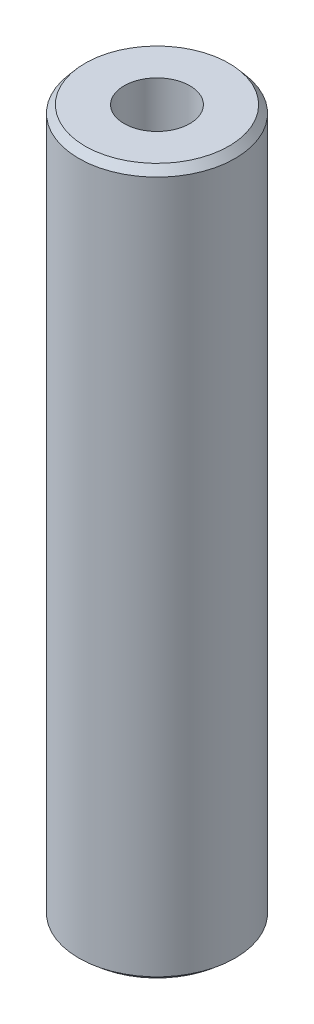
from build123d import *
from OCP.BRepFilletAPI import BRepFilletAPI_MakeChamfer

# Parameters (mm, degrees)
SKETCH1_R           = 7.5
BOSS_EXTRUDE1_DEPTH = 67.74205886
SKETCH2_R           = 3.150925498
CUT_EXTRUDE1_DEPTH  = 69.567386844
CHAMFER1_SIZE       = 0.717238058
CHAMFER1_SIZE2      = 0.606300994


with BuildPart() as part:
    # Sketch1 → Boss-Extrude1 (new body)
    with BuildSketch(Plane(origin=(0, 0, 0), x_dir=(1, 0, 0), z_dir=(0, 1, 0))):
        Circle(SKETCH1_R)
    extrude(amount=BOSS_EXTRUDE1_DEPTH)

    # Sketch2 → Cut-Extrude1 (cut, through all)
    with BuildSketch(Plane(origin=(0, 0, 0), x_dir=(1, 0, 0), z_dir=(0, 1, 0))):
        Circle(SKETCH2_R)
    extrude(amount=CUT_EXTRUDE1_DEPTH, mode=Mode.SUBTRACT)

    # Chamfer1: one chamfer whose edges measure the first distance from different faces: ONE call of the kernel's chamfer builder (chamfer() names one face for all edges)
    chamfer1_edges_1 = [part.edges().sort_by_distance(p)[0] for p in [
        (-7.5, 67.74205886, 0),
    ]]
    chamfer1_side_1 = [part.faces().sort_by_distance(p)[0] for p in [
        (-7.5, 33.87102943, 0),
    ]]
    chamfer1_edges_2 = [part.edges().sort_by_distance(p)[0] for p in [
        (-7.5, 0, 0),
    ]]
    chamfer1_side_2 = [part.faces().sort_by_distance(p)[0] for p in [
        (-7.287867966, 0, 0),
    ]]
    chamfer1 = BRepFilletAPI_MakeChamfer(part.part.solid().wrapped)
    for e in chamfer1_edges_1:
        chamfer1.Add(CHAMFER1_SIZE, CHAMFER1_SIZE2, e.wrapped, chamfer1_side_1[0].wrapped)  # the first distance lies on this face
    for e in chamfer1_edges_2:
        chamfer1.Add(CHAMFER1_SIZE, CHAMFER1_SIZE2, e.wrapped, chamfer1_side_2[0].wrapped)  # the first distance lies on this face
    add(Compound.cast(chamfer1.Shape()), mode=Mode.REPLACE)


solid = part.part
